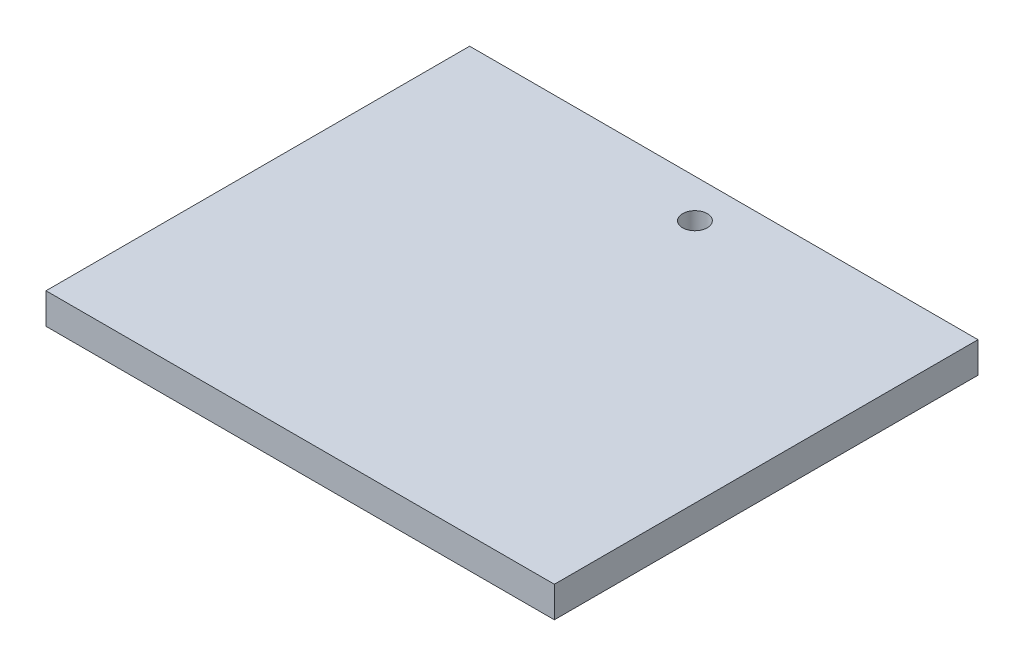
from build123d import *

# Parameters (mm, degrees)
SKETCH1_R           = 1.6
BOSS_EXTRUDE1_DEPTH = 4


with BuildPart() as part:
    # Sketch1 → Boss-Extrude1 (new body)
    with BuildSketch(Plane(origin=(0, 0, 0), x_dir=(1, 0, 0), z_dir=(0, 1, 0))):
        Polygon((33, -27.5), (33, 27.5), (1.25, 27.5), (-33, 27.5), (-33, -27.5), align=None)
        with Locations((1.25, 22.5)):
            Circle(SKETCH1_R, mode=Mode.SUBTRACT)
    extrude(amount=BOSS_EXTRUDE1_DEPTH)


solid = part.part
